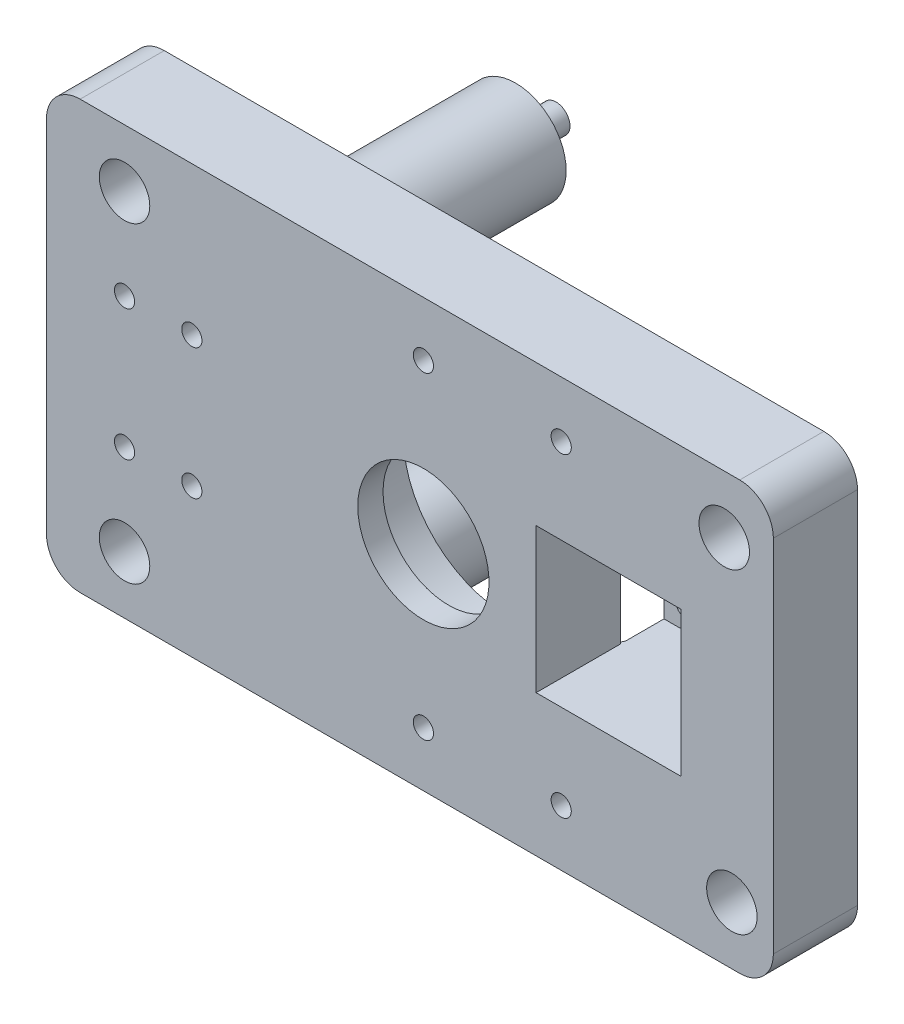
from build123d import *

# Parameters (mm, degrees)
SKETCH1_W            = 216
SKETCH1_H            = 127
BOSS_EXTRUDE1_DEPTH  = 25
FILLET1_R            = 10
FILLET2_R            = 10
SKETCH9_R            = 31
CUT_EXTRUDE4_DEPTH   = 17.5
SKETCH12_R           = 19.5
CUT_EXTRUDE5_DEPTH   = 127.500988138
SKETCH9_4_W          = 43
SKETCH9_4_H          = 43
CUT_EXTRUDE6_DEPTH   = 128.754647665
SKETCH13_W           = 43
SKETCH13_H           = 4
BOSS_EXTRUDE2_DEPTH  = 17
FILLET4_R            = 2
SKETCH17_W           = 43
SKETCH17_H           = 4
BOSS_EXTRUDE5_DEPTH  = 9
SKETCH18_W           = 43
SKETCH18_H           = 4
BOSS_EXTRUDE6_DEPTH  = 17
SKETCH19_W           = 43
SKETCH19_H           = 4
BOSS_EXTRUDE7_DEPTH  = 9
FILLET5_R            = 2
SKETCH20_R           = 1.85
CUT_EXTRUDE7_DEPTH   = 9
SKETCH23_R           = 1.85
CUT_EXTRUDE8_DEPTH   = 9
SKETCH25_R           = 15
BOSS_EXTRUDE9_DEPTH  = 48.84
SKETCH26_R           = 4.15
BOSS_EXTRUDE10_DEPTH = 12
SKETCH27_R           = 4.15
BOSS_EXTRUDE11_DEPTH = 12
FILLET9_R            = 2
FILLET10_R           = 2
SKETCH28_R           = 7.5
CUT_EXTRUDE9_DEPTH   = 152.870851713
SKETCH29_R           = 3
CUT_EXTRUDE11_DEPTH  = 140.275825612


with BuildPart() as part:
    # Sketch1 → Boss-Extrude1 (new body)
    with BuildSketch(Plane.XY):
        Rectangle(SKETCH1_W, SKETCH1_H)
    extrude(amount=BOSS_EXTRUDE1_DEPTH)

    # Fillet1
    fillet1_edges = [part.edges().sort_by_distance(p)[0] for p in [
        (-108, 63.5, 12.5),
    ]]
    fillet(fillet1_edges, radius=FILLET1_R)

    # Fillet2
    fillet2_edges = [part.edges().sort_by_distance(p)[0] for p in [
        (-108, -63.5, 12.5),
        (108, 63.5, 12.5),
        (108, -63.5, 12.5),
    ]]
    fillet(fillet2_edges, radius=FILLET2_R)

    # Sketch9 → Cut-Extrude4 (cut)
    with BuildSketch(Plane(origin=(0, 0, 0), x_dir=(-1, 0, 0), z_dir=(0, 0, -1))):
        with Locations((-4, 0)):
            Circle(SKETCH9_R)
    extrude(amount=-CUT_EXTRUDE4_DEPTH, mode=Mode.SUBTRACT)

    # Sketch12 → Cut-Extrude5 (cut, through all)
    with BuildSketch(Plane(origin=(0, 0, 17.5), x_dir=(-1, 0, 0), z_dir=(0, 0, -1))):
        with Locations((-4, 0)):
            Circle(SKETCH12_R)
    extrude(amount=-CUT_EXTRUDE5_DEPTH, mode=Mode.SUBTRACT)

    # Sketch9<4> → Cut-Extrude6 (cut, through all)
    with BuildSketch(Plane(origin=(0, 0, 0), x_dir=(-1, 0, 0), z_dir=(0, 0, -1))):
        with Locations((-59, 0)):
            Rectangle(SKETCH9_4_W, SKETCH9_4_H)
    extrude(amount=-CUT_EXTRUDE6_DEPTH, mode=Mode.SUBTRACT)

    # Sketch13 → Boss-Extrude2 (add)
    with BuildSketch(Plane(origin=(0, 0, 0), x_dir=(-1, 0, 0), z_dir=(0, 0, -1))):
        with Locations((-59, -23.5)):
            Rectangle(SKETCH13_W, SKETCH13_H)
    extrude(amount=BOSS_EXTRUDE2_DEPTH)

    # Fillet4
    fillet4_edges = [part.edges().sort_by_distance(p)[0] for p in [
        (59, -25.5, 0),
        (37.5, -23.5, 0),
        (80.5, -23.5, 0),
    ]]
    fillet(fillet4_edges, radius=FILLET4_R)

    # Sketch17 → Boss-Extrude5 (add)
    with BuildSketch(Plane(origin=(0, -21.5, 0), x_dir=(1, 0, 0), z_dir=(0, 1, 0))):
        with Locations((59, 15)):
            Rectangle(SKETCH17_W, SKETCH17_H)
    extrude(amount=BOSS_EXTRUDE5_DEPTH)

    # Sketch18 → Boss-Extrude6 (add)
    with BuildSketch(Plane(origin=(0, 0, 0), x_dir=(-1, 0, 0), z_dir=(0, 0, -1))):
        with Locations((-59, 23.5)):
            Rectangle(SKETCH18_W, SKETCH18_H)
    extrude(amount=BOSS_EXTRUDE6_DEPTH)

    # Sketch19 → Boss-Extrude7 (add)
    with BuildSketch(Plane(origin=(0, 21.5, 0), x_dir=(-1, 0, 0), z_dir=(0, -1, 0))):
        with Locations((-59, 15)):
            Rectangle(SKETCH19_W, SKETCH19_H)
    extrude(amount=BOSS_EXTRUDE7_DEPTH)

    # Fillet5
    fillet5_edges = [part.edges().sort_by_distance(p)[0] for p in [
        (37.5, 23.5, 0),
        (80.5, 23.5, 0),
        (59, 25.5, 0),
    ]]
    fillet(fillet5_edges, radius=FILLET5_R)

    # Sketch20 → Cut-Extrude7 (cut)
    with BuildSketch(Plane(origin=(0, 0, -17), x_dir=(-1, 0, 0), z_dir=(0, 0, -1))):
        with Locations((-43.15, -16)):
            Circle(SKETCH20_R)
        with Locations((-74.85, -16)):
            Circle(SKETCH20_R)
    extrude(amount=-CUT_EXTRUDE7_DEPTH, mode=Mode.SUBTRACT)

    # Sketch23 → Cut-Extrude8 (cut)
    with BuildSketch(Plane(origin=(0, 0, -17), x_dir=(-1, 0, 0), z_dir=(0, 0, -1))):
        with Locations((-43.15, 15.85)):
            Circle(SKETCH23_R)
        with Locations((-74.85, 16)):
            Circle(SKETCH23_R)
    extrude(amount=-CUT_EXTRUDE8_DEPTH, mode=Mode.SUBTRACT)

    # Sketch25 → Boss-Extrude9 (add)
    with BuildSketch(Plane(origin=(0, 0, 0), x_dir=(-1, 0, 0), z_dir=(0, 0, -1))):
        with Locations((42.424121096, -43.5)):
            Circle(SKETCH25_R)
        with Locations((42.424121096, 43.5)):
            Circle(SKETCH25_R)
    extrude(amount=BOSS_EXTRUDE9_DEPTH)

    # Sketch26 → Boss-Extrude10 (add)
    with BuildSketch(Plane(origin=(0, 0, -48.84), x_dir=(-1, 0, 0), z_dir=(0, 0, -1))):
        with Locations((42.424121096, -43.5)):
            Circle(SKETCH26_R)
    extrude(amount=BOSS_EXTRUDE10_DEPTH)

    # Sketch27 → Boss-Extrude11 (add)
    with BuildSketch(Plane(origin=(0, 0, -48.84), x_dir=(-1, 0, 0), z_dir=(0, 0, -1))):
        with Locations((42.424121096, 43.5)):
            Circle(SKETCH27_R)
    extrude(amount=BOSS_EXTRUDE11_DEPTH)

    # Fillet9
    fillet9_edges = [part.edges().sort_by_distance(p)[0] for p in [
        (-27.424121096, -43.5, 0),
    ]]
    fillet(fillet9_edges, radius=FILLET9_R)

    # Fillet10
    fillet10_edges = [part.edges().sort_by_distance(p)[0] for p in [
        (-27.424121096, 43.5, 0),
    ]]
    fillet(fillet10_edges, radius=FILLET10_R)

    # Sketch28 → Cut-Extrude9 (cut, through all)
    with BuildSketch(Plane.XY.offset(25)):
        with Locations((-84.811667967, 46.37)):
            Circle(SKETCH28_R)
        with Locations((-84.811667967, -46.37)):
            Circle(SKETCH28_R)
        with Locations((95.674047271, -46.369786546)):
            Circle(SKETCH28_R)
        with Locations((93.399057455, 46.37)):
            Circle(SKETCH28_R)
    extrude(amount=-CUT_EXTRUDE9_DEPTH, mode=Mode.SUBTRACT)

    # Sketch29 → Cut-Extrude11 (cut, through all)
    with BuildSketch(Plane(origin=(0, 0, 0), x_dir=(-1, 0, 0), z_dir=(0, 0, -1))):
        with Locations((-44.949528727, 46.81)):
            Circle(SKETCH29_R)
        with Locations((-4, 47.25)):
            Circle(SKETCH29_R)
        with Locations((-4, -47.25)):
            Circle(SKETCH29_R)
        with Locations((-44.949528727, -46.81)):
            Circle(SKETCH29_R)
        with Locations((84.811667967, -19.435)):
            Circle(SKETCH29_R)
        with Locations((84.811667967, 19.435)):
            Circle(SKETCH29_R)
        with Locations((64.811667967, 19.435)):
            Circle(SKETCH29_R)
        with Locations((64.811667967, -19.435)):
            Circle(SKETCH29_R)
    extrude(amount=-CUT_EXTRUDE11_DEPTH, mode=Mode.SUBTRACT)


solid = part.part
